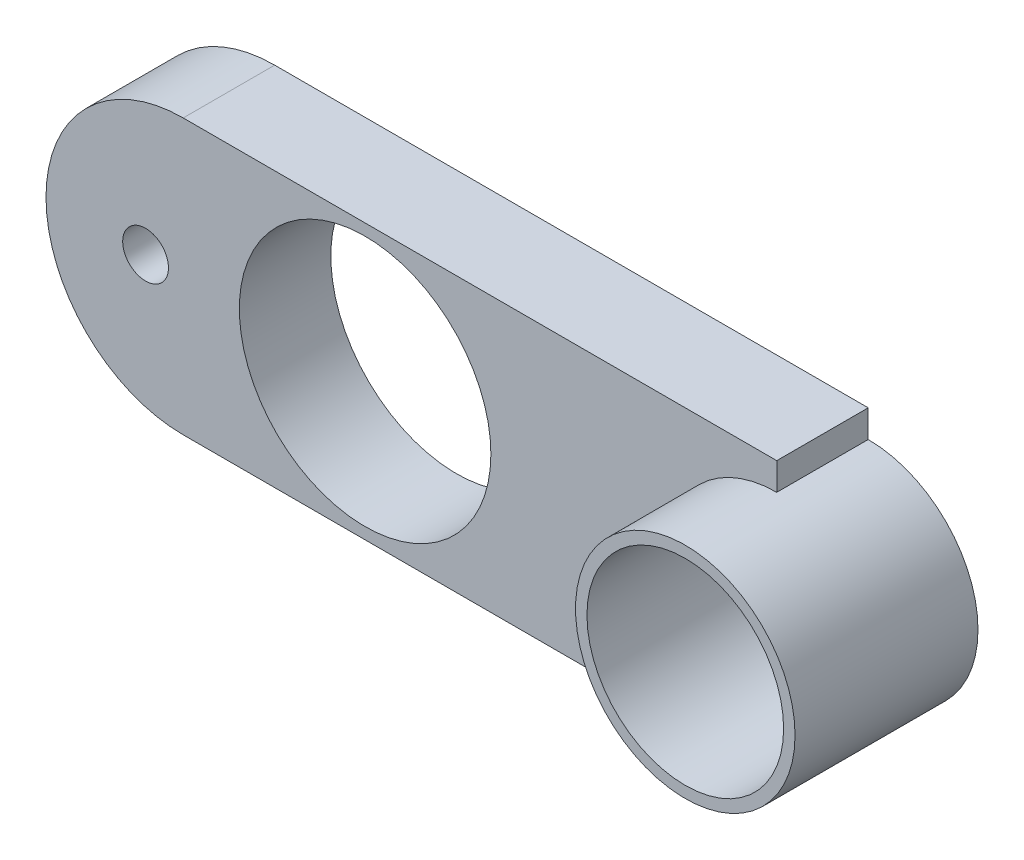
from build123d import *
from build123d.topology import SkipClean

# Parameters (mm, degrees)
SKETCH1_R           = 30
BOSS_EXTRUDE1_DEPTH = 20
SKETCH2_R           = 27.5
CUT_EXTRUDE1_DEPTH  = 47.904157598
BOSS_EXTRUDE2_START = -20
BOSS_EXTRUDE2_DEPTH = 20
SKETCH6_R           = 21.5
CUT_EXTRUDE2_DEPTH  = 35
SKETCH11_R          = 24
BOSS_EXTRUDE3_DEPTH = 20
BOSS_EXTRUDE4_START = -40
SKETCH12_R          = 24
BOSS_EXTRUDE4_DEPTH = 40
SKETCH13_R          = 21.5
CUT_EXTRUDE6_DEPTH  = 35
BOSS_EXTRUDE6_START = -20
BOSS_EXTRUDE6_DEPTH = 20
SKETCH15_R          = 5
CUT_EXTRUDE8_DEPTH  = 20
FILLET1_R           = 30
FILLET2_R           = 30


with BuildPart() as part:
    # Sketch1 → Boss-Extrude1 (new body)
    with BuildSketch(Plane.XY):
        Circle(SKETCH1_R)
    extrude(amount=BOSS_EXTRUDE1_DEPTH)

    # Sketch2 → Cut-Extrude1 (cut, through all)
    with BuildSketch(Plane.XY.offset(20)):
        Circle(SKETCH2_R)
    extrude(amount=-CUT_EXTRUDE1_DEPTH, mode=Mode.SUBTRACT)

    # Sketch4 → Boss-Extrude2 (add)
    with BuildSketch(Plane.XY.offset(20).offset(BOSS_EXTRUDE2_START)):
        with BuildLine():
            Line((0, 30), (90, 30))
            Line((90, 30), (90, 24))
            ThreePointArc((90, 24), (114, 0), (90, -24))
            Line((90, -24), (90, -30))
            Line((90, -30), (0, -30))
            ThreePointArc((0, -30), (30, 0), (0, 30))
        make_face()
    extrude(amount=BOSS_EXTRUDE2_DEPTH)

    # Sketch6 → Cut-Extrude2 (cut)
    with BuildSketch(Plane.XY.offset(20)):
        with Locations((90, 0)):
            Circle(SKETCH6_R)
    extrude(amount=-CUT_EXTRUDE2_DEPTH, mode=Mode.SUBTRACT)

    # Sketch11 → Boss-Extrude3 (add)
    with SkipClean():  # the faces are left unmerged after this step: merging them gives an invalid solid
        with BuildSketch(Plane.XY.offset(20)):
            with Locations((90, 0)):
                Circle(SKETCH11_R)
        extrude(amount=BOSS_EXTRUDE3_DEPTH)
    add(part.part.scale(1), mode=Mode.REPLACE)  # the faces are merged on a copy

    # Sketch12 → Boss-Extrude4 (add)
    with SkipClean():  # the faces are left unmerged after this step: merging them gives an invalid solid
        with BuildSketch(Plane.XY.offset(40).offset(BOSS_EXTRUDE4_START)):
            with Locations((90, 0)):
                Circle(SKETCH12_R)
        extrude(amount=BOSS_EXTRUDE4_DEPTH)

    # Sketch13 → Cut-Extrude6 (cut)
    with SkipClean():  # the faces are left unmerged after this step: merging them gives an invalid solid
        with BuildSketch(Plane.XY.offset(40)):
            with Locations((90, 0)):
                Circle(SKETCH13_R)
        extrude(amount=-CUT_EXTRUDE6_DEPTH, mode=Mode.SUBTRACT)

    # Sketch14 → Boss-Extrude6 (add)
    with BuildSketch(Plane.XY.offset(20).offset(BOSS_EXTRUDE6_START)):
        with BuildLine():
            ThreePointArc((0, 30), (-30, 0), (0, -30))
            Line((0, -30), (-69.770044623, -30))
            Line((-69.770044623, -30), (-69.770044623, 30))
            Line((-69.770044623, 30), (0, 30))
        make_face()
    extrude(amount=BOSS_EXTRUDE6_DEPTH)

    # Sketch15 → Cut-Extrude8 (cut)
    with BuildSketch(Plane.XY.offset(20)):
        with Locations((-48, 0)):
            Circle(SKETCH15_R)
    extrude(amount=-CUT_EXTRUDE8_DEPTH, mode=Mode.SUBTRACT)

    # Fillet1
    fillet1_edges = [part.edges().sort_by_distance(p)[0] for p in [
        (-69.770044623, -30, 10),
    ]]
    fillet(fillet1_edges, radius=FILLET1_R)

    # Fillet2
    fillet2_edges = [part.edges().sort_by_distance(p)[0] for p in [
        (-69.770044623, 30, 10),
    ]]
    fillet(fillet2_edges, radius=FILLET2_R - 0.0001)  # a hair under: the kernel refuses the full size


solid = part.part
